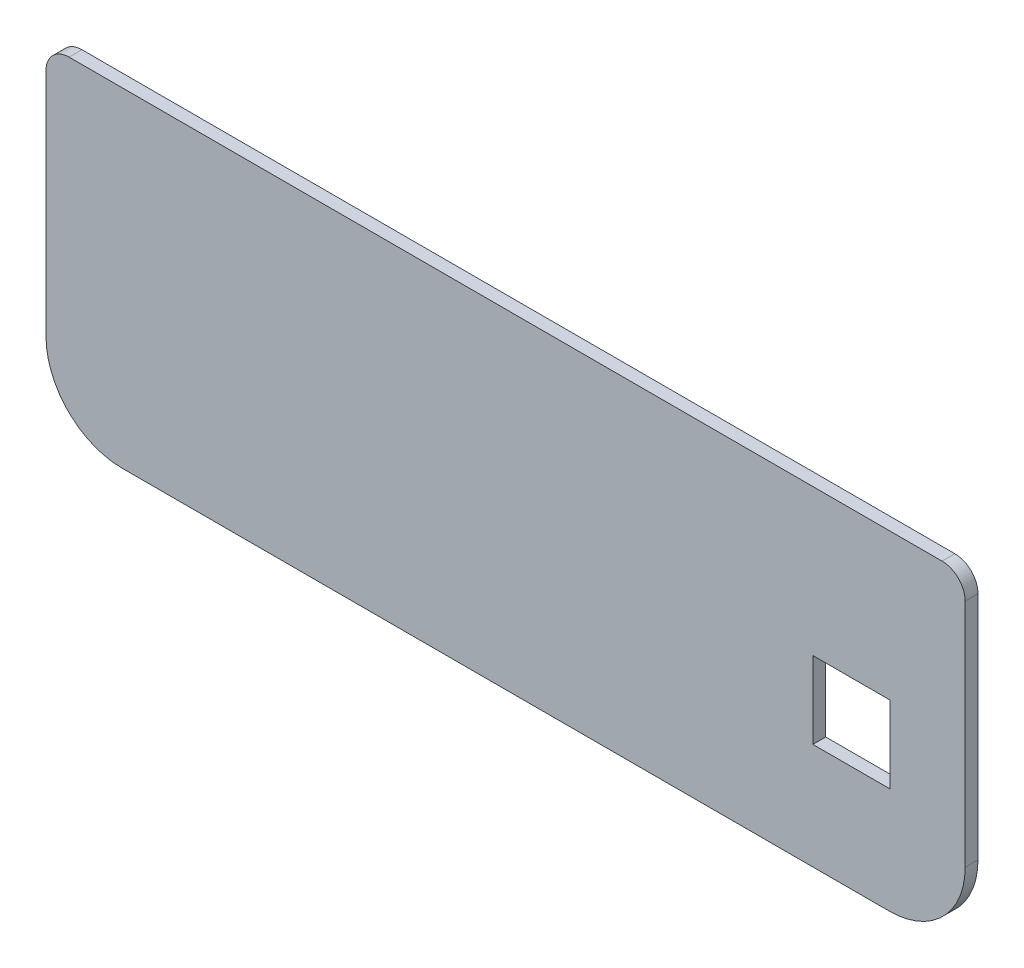
from build123d import *

# Parameters (mm, degrees)
BOSS_EXTRU_1_DEPTH      = 2.5
ESQUISSE21_W            = 15
ESQUISSE21_H            = 15
ENL_V_MAT_EXTRU_1_DEPTH = 10


with BuildPart() as part:
    # Esquisse20 → Boss.-Extru.1 (new body)
    with BuildSketch(Plane.XY):
        with BuildLine():
            Line((14.8, -2), (164.37, -2))
            ThreePointArc((164.37, -2), (174.835180362, 2.334819638), (179.17, 12.8))
            Line((179.17, 12.8), (179.17, 57.73))
            ThreePointArc((179.17, 57.73), (177.851980515, 60.911980515), (174.67, 62.23))
            Line((174.67, 62.23), (4.5, 62.23))
            ThreePointArc((4.5, 62.23), (1.318019485, 60.911980515), (0, 57.73))
            Line((0, 57.73), (0, 12.8))
            ThreePointArc((0, 12.8), (4.334819638, 2.334819638), (14.8, -2))
        make_face()
    extrude(amount=BOSS_EXTRU_1_DEPTH)

    # Esquisse21 → Enlèv. mat.-Extru.1 (cut)
    with BuildSketch(Plane(origin=(0, 0, 0), x_dir=(-1, 0, 0), z_dir=(0, 0, -1))):
        with Locations((-156.984770932, 26.202035665)):
            Rectangle(ESQUISSE21_W, ESQUISSE21_H)
    extrude(amount=-ENL_V_MAT_EXTRU_1_DEPTH, mode=Mode.SUBTRACT)


solid = part.part
